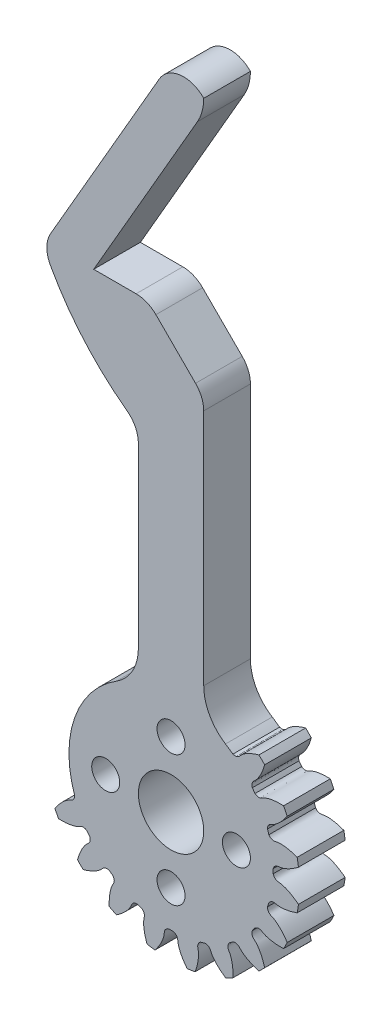
from build123d import *

# Parameters (mm, degrees)
SKETCH_1_R               = 13.75
EXTRUDE_1_DEPTH          = 5
CUT_EXTRUDE_1_DEPTH      = 21.077973005
PATTERN_CIRCULAR_1_COUNT = 20
EXTRUDE_2_DEPTH          = 5
SKETCH_4_R               = 3.5
SKETCH_4_R_2             = 1.5
CUT_EXTRUDE_2_DEPTH      = 20
CUT_EXTRUDE_START        = -10
CUT_EXTRUDE_5_DEPTH      = 10
CUT_EXTRUDE_7_DEPTH      = 10
FILLET_7_R               = 5
FILLET_8_R               = 3
CHAMFER_1_SIZE           = 6
FILLET_10_R              = 3
FILLET_11_R              = 5
FILLET_12_R              = 3


with BuildPart() as part:
    # 草图1 → 凸台-拉伸1 (new body)
    with BuildSketch(Plane.XY):
        Circle(SKETCH_1_R)
    extrude(amount=EXTRUDE_1_DEPTH)

    # 草图2 → 切除-拉伸1 (cut, through all)
    with BuildSketch(Plane.XY):
        with BuildLine():
            ThreePointArc((0.241645751, 10.934830295), (0, 10.9375), (-0.241645751, 10.934830295))
            add(Edge.make_bspline(
                [(-0.241645751, 10.934830295), (-0.763986756, 11.11684439), (-0.696355124, 11.483892124), (-0.766121321, 11.837511753), (-0.773615233, 11.871945767), (-0.782888612, 11.910793269), (-0.794115121, 11.953996045), (-0.807473925, 12.001489371), (-0.823140069, 12.053203535), (-0.841287339, 12.109063416), (-0.862087187, 12.168988684), (-0.885708875, 12.232893806), (-0.912319248, 12.300688126), (-0.942082628, 12.372275913), (-0.975160664, 12.447556439), (-1.011712206, 12.526424039), (-1.051893167, 12.608768189), (-1.095856396, 12.694473577), (-1.143751548, 12.783420187), (-1.195724957, 12.87548338), (-1.251919512, 12.970533976), (-1.312474533, 13.068438347), (-1.377525652, 13.169058507), (-1.447204695, 13.272252205), (-1.521639564, 13.377873025), (-1.600954126, 13.485770488), (-1.685268101, 13.595790151), (-1.774696952, 13.707773716), (-1.869351783, 13.821559139), (-1.969339231, 13.936980743), (-2.074761371, 14.053869328), (-2.185715611, 14.172052294), (-2.302294605, 14.291353753), (-2.424586158, 14.411594659), (-2.552673133, 14.532592924), (-2.686633373, 14.654163553), (-2.826539612, 14.776118764), (-2.972459398, 14.898268124), (-3.124455015, 15.020418683), (-3.282583418, 15.142375102), (-3.446896124, 15.2639398), (-3.676841988, 15.427049835), (-3.854915516, 15.545415751), (-3.976447477, 15.622814825)],
                knots=[0, 0, 0, 0, 0.165916003, 0.170905922, 0.176663519, 0.183188797, 0.190481754, 0.198542391, 0.207370708, 0.216966704, 0.22733038, 0.238461736, 0.250360771, 0.263027487, 0.276461881, 0.290663956, 0.30563371, 0.321371144, 0.337876258, 0.355149051, 0.373189524, 0.391997677, 0.411573509, 0.431917021, 0.453028213, 0.474907084, 0.497553636, 0.520967867, 0.545149777, 0.570099367, 0.595816637, 0.622301587, 0.649554216, 0.677574526, 0.706362514, 0.735918183, 0.766241531, 0.797332559, 0.829191267, 0.861817654, 0.895211721, 0.929373468, 1, 1, 1, 1], degree=3))
            ThreePointArc((-3.976447477, 15.622814825), (0, 16.120932901), (3.976447477, 15.622814825))
            add(Edge.make_bspline(
                [(0.241645751, 10.934830295), (0.763986756, 11.11684439), (0.696355124, 11.483892124), (0.766121321, 11.837511753), (0.773615233, 11.871945767), (0.782888612, 11.910793269), (0.794115121, 11.953996045), (0.807473925, 12.001489371), (0.823140069, 12.053203535), (0.841287339, 12.109063416), (0.862087187, 12.168988684), (0.885708875, 12.232893806), (0.912319248, 12.300688126), (0.942082628, 12.372275913), (0.975160664, 12.447556439), (1.011712206, 12.526424039), (1.051893167, 12.608768189), (1.095856396, 12.694473577), (1.143751548, 12.783420187), (1.195724957, 12.87548338), (1.251919512, 12.970533976), (1.312474533, 13.068438347), (1.377525652, 13.169058507), (1.447204695, 13.272252205), (1.521639564, 13.377873025), (1.600954126, 13.485770488), (1.685268101, 13.595790151), (1.774696952, 13.707773716), (1.869351783, 13.821559139), (1.969339231, 13.936980743), (2.074761371, 14.053869328), (2.185715611, 14.172052294), (2.302294605, 14.291353753), (2.424586158, 14.411594659), (2.552673133, 14.532592924), (2.686633373, 14.654163553), (2.826539612, 14.776118764), (2.972459398, 14.898268124), (3.124455015, 15.020418683), (3.282583418, 15.142375102), (3.446896124, 15.2639398), (3.676841988, 15.427049835), (3.854915516, 15.545415751), (3.976447477, 15.622814825)],
                knots=[0, 0, 0, 0, 0.165916003, 0.170905922, 0.176663519, 0.183188797, 0.190481754, 0.198542391, 0.207370708, 0.216966704, 0.22733038, 0.238461736, 0.250360771, 0.263027487, 0.276461881, 0.290663956, 0.30563371, 0.321371144, 0.337876258, 0.355149051, 0.373189524, 0.391997677, 0.411573509, 0.431917021, 0.453028213, 0.474907084, 0.497553636, 0.520967867, 0.545149777, 0.570099367, 0.595816637, 0.622301587, 0.649554216, 0.677574526, 0.706362514, 0.735918183, 0.766241531, 0.797332559, 0.829191267, 0.861817654, 0.895211721, 0.929373468, 1, 1, 1, 1], degree=3))
        make_face()
    cut_extrude_1 = extrude(amount=CUT_EXTRUDE_1_DEPTH, mode=Mode.SUBTRACT)

    # 阵列(圆周)1: 切除-拉伸1 ×20 about axis
    pattern_circular_1_axis = Axis((0, 0, -1.5), (0, 0, 1))
    for i in range(1, PATTERN_CIRCULAR_1_COUNT):
        add(cut_extrude_1.rotate(pattern_circular_1_axis, i * 360 / PATTERN_CIRCULAR_1_COUNT), mode=Mode.SUBTRACT)

    # 草图6 → 凸台-拉伸2 (add)
    with BuildSketch(Plane(origin=(0, 0, 0), x_dir=(-1, 0, 0), z_dir=(0, 0, -1))):
        with BuildLine():
            Line((-3.5, 0), (3.5, 0))
            Line((3.5, 0), (3.5, 10.32690032))
            Line((3.5, 10.32690032), (3.5, 13.800605072))
            Line((3.5, 13.800605072), (3.5, 34.033226755))
            Line((3.5, 34.033226755), (3.5, 35.971404539))
            ThreePointArc((3.5, 35.971404539), (8.908375336, 41.112064255), (12.729597406, 47.521055438))
            Line((12.729597406, 47.521055438), (10.503631691, 51.376541152))
            ThreePointArc((10.503631691, 51.376541152), (9.73826536, 49.194505344), (8.766458976, 47.096254111))
            ThreePointArc((8.766458976, 47.096254111), (9.150635095, 45.72), (7.766676014, 45.364579223))
            ThreePointArc((7.766676014, 45.364579223), (2.868556012, 39.78613209), (-3.5, 35.971404539))
            Line((-3.5, 35.971404539), (-3.5, 13.800605072))
            Line((-3.5, 13.800605072), (-3.5, 10.32690032))
            Line((-3.5, 10.32690032), (-3.5, 0))
        make_face()
        with BuildLine():
            Line((3.5, 13.800605072), (3.5, 10.32690032))
            add(Edge.make_bspline(
                [(3.5, 10.32690032), (4.156413811, 10.291875113), (4.200761863, 10.688312594), (4.393103935, 11.03302397), (4.418885843, 11.076011904), (4.458931571, 11.138710403), (4.509766902, 11.213065778), (4.58267603, 11.311112911), (4.671237054, 11.420807284), (4.776478734, 11.5410308), (4.899365137, 11.670602183), (5.040791529, 11.808280759), (5.201581362, 11.952770029), (5.38248323, 12.10272148), (5.584168076, 12.256738531), (5.744241751, 12.369149234), (5.836552423, 12.430773747), (5.853360338, 12.441891848)],
                knots=[0.482278834, 0.482278834, 0.482278834, 0.482278834, 0.658484305, 0.663474224, 0.675757099, 0.683050056, 0.69993901, 0.719898682, 0.742929074, 0.769030183, 0.798202012, 0.83044456, 0.865757826, 0.904141811, 0.945596515, 0.990121938, 1, 1, 1, 1], degree=3))
            Line((5.853360338, 12.441891848), (3.5, 13.800605072))
        make_face()
        with BuildLine():
            add(Edge.make_bspline(
                [(-3.5, 10.32690032), (-4.156413811, 10.291875113), (-4.200761863, 10.688312594), (-4.393103935, 11.03302397), (-4.418885843, 11.076011904), (-4.458931571, 11.138710403), (-4.509766902, 11.213065778), (-4.58267603, 11.311112911), (-4.671237054, 11.420807284), (-4.776478734, 11.5410308), (-4.899365137, 11.670602183), (-5.040791529, 11.808280759), (-5.201581362, 11.952770029), (-5.38248323, 12.10272148), (-5.584168076, 12.256738531), (-5.744241751, 12.369149234), (-5.836552423, 12.430773747), (-5.853360338, 12.441891848)],
                knots=[-0.010289468, -0.010289468, -0.010289468, -0.010289468, 0.165916003, 0.170905922, 0.183188797, 0.190481754, 0.207370708, 0.22733038, 0.250360771, 0.276461881, 0.30563371, 0.337876258, 0.373189524, 0.411573509, 0.453028213, 0.497553636, 0.507431698, 0.507431698, 0.507431698, 0.507431698], degree=3))
            Line((-3.5, 10.32690032), (-3.5, 13.800605072))
            Line((-3.5, 13.800605072), (-5.853360338, 12.441891848))
        make_face()
        with BuildLine():
            Line((3.5, 35.971404539), (3.5, 34.033226755))
            ThreePointArc((3.5, 34.033226755), (9.413700923, 39.225534705), (13.71365918, 45.816610448))
            Line((13.71365918, 45.816610448), (12.729597406, 47.521055438))
            ThreePointArc((12.729597406, 47.521055438), (8.908375336, 41.112064255), (3.5, 35.971404539))
        make_face()
        with BuildLine():
            Line((-3.5, 46.22), (-3.5, 35.971404539))
            ThreePointArc((-3.5, 35.971404539), (2.868556012, 39.78613209), (7.766676014, 45.364579223))
            ThreePointArc((7.766676014, 45.364579223), (7.413422662, 45.729048718), (7.284609691, 46.22))
            Line((7.284609691, 46.22), (-3.5, 46.22))
        make_face()
        with BuildLine():
            ThreePointArc((7.284609691, 46.22), (7.413422662, 45.729048718), (7.766676014, 45.364579223))
            ThreePointArc((7.766676014, 45.364579223), (8.030098652, 45.789591747), (8.284609691, 46.22))
            Line((8.284609691, 46.22), (7.284609691, 46.22))
        make_face()
        with BuildLine():
            ThreePointArc((8.284609691, 46.22), (8.030098652, 45.789591747), (7.766676014, 45.364579223))
            ThreePointArc((7.766676014, 45.364579223), (9.150635095, 45.72), (8.766458976, 47.096254111))
            ThreePointArc((8.766458976, 47.096254111), (8.530098652, 46.655617151), (8.284609691, 46.22))
        make_face()
        with BuildLine():
            ThreePointArc((8.766458976, 47.096254111), (9.73826536, 49.194505344), (10.503631691, 51.376541152))
            Line((10.503631691, 51.376541152), (-2.973720558, 74.72))
            Line((-2.973720558, 74.72), (-3.5, 73.808457268))
            Line((-3.5, 73.808457268), (-3.5, 66.631542732))
            Line((-3.5, 66.631542732), (7.784609691, 47.086025404))
            ThreePointArc((7.784609691, 47.086025404), (8.274192459, 47.219945739), (8.766458976, 47.096254111))
        make_face()
        with BuildLine():
            Line((7.784609691, 47.086025404), (8.284609691, 46.22))
            ThreePointArc((8.284609691, 46.22), (8.530098652, 46.655617151), (8.766458976, 47.096254111))
            ThreePointArc((8.766458976, 47.096254111), (8.274192459, 47.219945739), (7.784609691, 47.086025404))
        make_face()
        Polygon((-3.5, 73.808457268), (-2.973720558, 74.72), (-3.5, 75.631542732), align=None)
    extrude(amount=-EXTRUDE_2_DEPTH)

    # 草图4 → 切除-拉伸2 (cut)
    with BuildSketch(Plane.XY.offset(5)):
        Circle(SKETCH_4_R)
        with Locations((0, 7)):
            Circle(SKETCH_4_R_2)
        with Locations((7, 0)):
            Circle(SKETCH_4_R_2)
        with Locations((0, -7)):
            Circle(SKETCH_4_R_2)
        with Locations((-7, 0)):
            Circle(SKETCH_4_R_2)
    extrude(amount=-CUT_EXTRUDE_2_DEPTH, mode=Mode.SUBTRACT)

    # 草图17 → 切除-拉伸5 (cut)
    with BuildSketch(Plane.XY.offset(5).offset(CUT_EXTRUDE_START)):
        with BuildLine():
            ThreePointArc((-10.324968963, -3.608867158), (-10.47431425, 3.149229626), (-6.622827503, 8.704427731))
            Line((-6.622827503, 8.704427731), (-10.596524004, 13.927084369))
            ThreePointArc((-10.596524004, 13.927084369), (-16.7589028, 5.038767402), (-16.519950341, -5.774187452))
            Line((-16.519950341, -5.774187452), (-10.324968963, -3.608867158))
        make_face()
    extrude(amount=CUT_EXTRUDE_5_DEPTH, mode=Mode.SUBTRACT)

    # 草图20 → 切除-拉伸7 (cut)
    with BuildSketch(Plane(origin=(0, 0, 0), x_dir=(-1, 0, 0), z_dir=(0, 0, -1))):
        with BuildLine():
            Line((-3.5, 10.362379372), (-3.5, 13.800605072))
            Line((-3.5, 13.800605072), (-5.853360338, 12.441891848))
            ThreePointArc((-5.853360338, 12.441891848), (-6.242369371, 12.251339708), (-6.625183064, 12.048628526))
            add(Edge.make_bspline(
                [(-6.231836465, 8.988499348), (-5.916238915, 9.442776183), (-6.1866993, 9.699971162), (-6.343702187, 10.03914452), (-6.36332593, 10.085270195), (-6.390511793, 10.154521122), (-6.420786297, 10.239352761), (-6.457253184, 10.355968144), (-6.493942932, 10.492092252), (-6.529346293, 10.647900169), (-6.561940927, 10.823477506), (-6.590196887, 11.018819297), (-6.61258127, 11.233829666), (-6.627563092, 11.468321604), (-6.633618126, 11.722017023), (-6.630471349, 11.9175927), (-6.626067777, 12.028495582), (-6.625183064, 12.048628526)],
                knots=[0.492568302, 0.492568302, 0.492568302, 0.492568302, 0.658484305, 0.663474224, 0.675757099, 0.683050056, 0.69993901, 0.719898682, 0.742929074, 0.769030183, 0.798202012, 0.83044456, 0.865757826, 0.904141811, 0.945596515, 0.990121938, 1, 1, 1, 1], degree=3))
            ThreePointArc((-6.231836465, 8.988499348), (-4.914167969, 9.771379607), (-3.5, 10.362379372))
        make_face()
        with BuildLine():
            Line((3.5, 13.800605072), (3.5, 10.362379372))
            ThreePointArc((3.5, 10.362379372), (4.914167969, 9.771379607), (6.231836465, 8.988499348))
            add(Edge.make_bspline(
                [(6.231836465, 8.988499348), (5.916238915, 9.442776183), (6.1866993, 9.699971162), (6.343702187, 10.03914452), (6.36332593, 10.085270195), (6.390511793, 10.154521122), (6.420786297, 10.239352761), (6.457253184, 10.355968144), (6.493942932, 10.492092252), (6.529346293, 10.647900169), (6.561940927, 10.823477506), (6.590196887, 11.018819297), (6.61258127, 11.233829666), (6.627563092, 11.468321604), (6.633618126, 11.722017023), (6.630471349, 11.9175927), (6.626067777, 12.028495582), (6.625183064, 12.048628526)],
                knots=[0, 0, 0, 0, 0.165916003, 0.170905922, 0.183188797, 0.190481754, 0.207370708, 0.22733038, 0.250360771, 0.276461881, 0.30563371, 0.337876258, 0.373189524, 0.411573509, 0.453028213, 0.497553636, 0.507431698, 0.507431698, 0.507431698, 0.507431698], degree=3))
            ThreePointArc((6.625183064, 12.048628526), (6.242369371, 12.251339708), (5.853360338, 12.441891848))
            Line((5.853360338, 12.441891848), (3.5, 13.800605072))
        make_face()
    extrude(amount=-CUT_EXTRUDE_7_DEPTH, mode=Mode.SUBTRACT)

    # 圆角7
    fillet_7_edges = [part.edges().sort_by_distance(p)[0] for p in [
        (3.5, 10.362379372, 2.5),
        (-3.5, 10.362379372, 2.5),
    ]]
    fillet(fillet_7_edges, radius=FILLET_7_R)

    # 圆角8
    fillet_8_edges = [part.edges().sort_by_distance(p)[0] for p in [
        (-13.71365918, 45.816610448, 2.5),
        (-3.5, 34.033226755, 2.5),
    ]]
    fillet(fillet_8_edges, radius=FILLET_8_R)

    # 倒角1
    chamfer_1_edges = [part.edges().sort_by_distance(p)[0] for p in [
        (3.5, 46.22, 2.5),
    ]]
    chamfer(chamfer_1_edges, length=CHAMFER_1_SIZE)

    # 圆角10
    fillet_10_edges = [part.edges().sort_by_distance(p)[0] for p in [
        (-2.5, 46.22, 2.5),
        (3.5, 40.22, 2.5),
    ]]
    fillet(fillet_10_edges, radius=FILLET_10_R)

    # 圆角11
    fillet_11_edges = [part.edges().sort_by_distance(p)[0] for p in [
        (3.5, 66.631542732, 2.5),
    ]]
    fillet(fillet_11_edges, radius=FILLET_11_R)

    # 圆角12
    # the kernel refuses this fillet: 3 mm, written as the material it takes off along each edge
    with BuildSketch(Plane(origin=(3.5, 75.631542732, -23.792089679), x_dir=(0, -1, 0), z_dir=(0, 0, 1))) as fillet_12_piece_1:
        with BuildLine():
            CenterArc((9.741821628, -2.160341724), FILLET_12_R, 133.936114296, 106.063885704)
            Line((8.241821628, -4.758417936), (8.211821628, -4.81037946))
            Line((8.211821628, -4.81037946), (-0.03, -0.051961524))
            Line((-0.03, -0.051961524), (0, 0.06))
            ThreePointArc((0, 0.06), (3.830127019, 0.06), (7.618622686, 0.043206834))
            Line((7.618622686, 0.043206834), (7.660254038, 0))
        make_face()
    extrude(amount=52.584179357, mode=Mode.SUBTRACT)


solid = part.part
